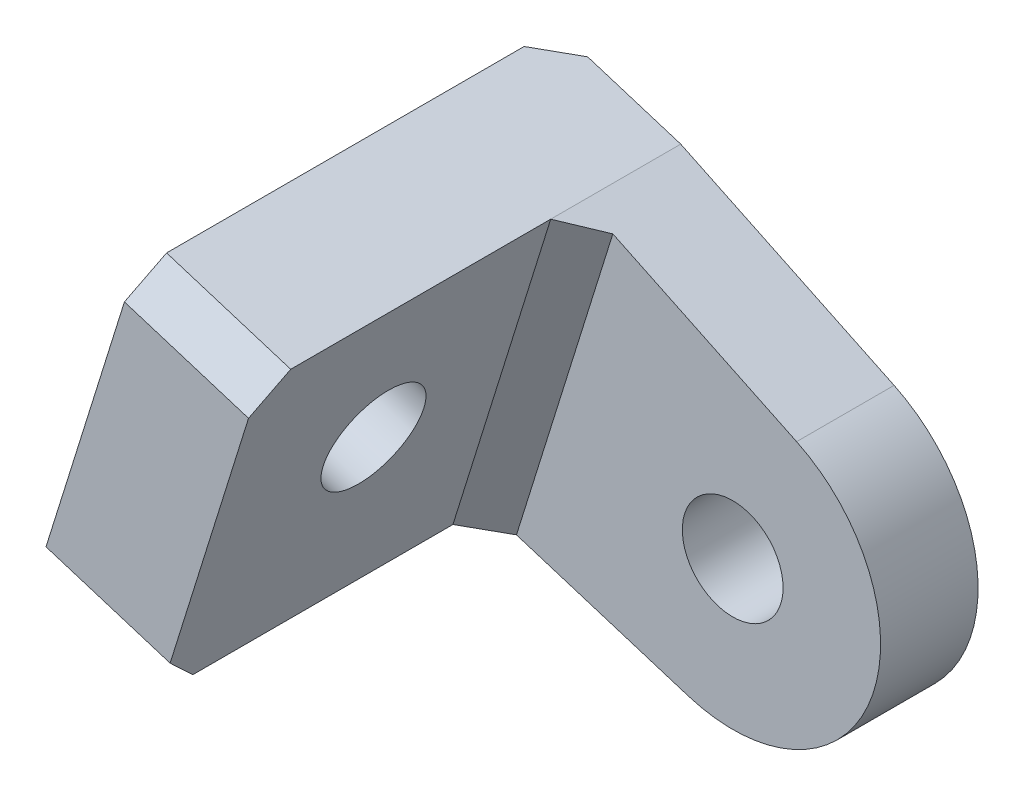
from build123d import *

# Parameters (mm, degrees)
SKETCH1_R           = 1.55
BOSS_EXTRUDE1_DEPTH = 3
BOSS_EXTRUDE2_DEPTH = 10
CUT_EXTRUDE1_REACH  = 40.814
SKETCH3_RX          = 1.55
SKETCH3_RY          = 1.549991194
CHAMFER1_SIZE       = 1
CHAMFER2_SIZE       = 1
CHAMFER3_SIZE       = 1


with BuildPart() as part:
    # Sketch1 → Boss-Extrude1 (new body)
    with BuildSketch(Plane.XY):
        with BuildLine():
            Line((9.241088209, 28.022032198), (2.675653796, 31.16807272))
            Line((2.675653796, 31.16807272), (-1.142729479, 32.359688918))
            Line((-1.142729479, 32.359688918), (-4.151560379, 22.718271148))
            Line((-4.151560379, 22.718271148), (5.91942551, 19.575383426))
            ThreePointArc((5.91942551, 19.575383426), (11.509238759, 22.253627274), (9.241088209, 28.022032198))
        make_face()
        with Locations((7.274888935, 23.918794401)):
            Circle(SKETCH1_R, mode=Mode.SUBTRACT)
    extrude(amount=BOSS_EXTRUDE1_DEPTH)

    # Sketch2 → Boss-Extrude2 (add)
    with BuildSketch(Plane.XY.offset(3)):
        Polygon((-1.142729479, 32.359688918), (-4.151560379, 22.718271148), (-0.333177104, 21.52665495), (2.675653796, 31.16807272), align=None)
    extrude(amount=BOSS_EXTRUDE2_DEPTH)

    # Sketch3 → Cut-Extrude1 (cut, up to next)
    with BuildSketch(Plane(origin=(-10.243698191, 3.196786653, 0), x_dir=(0, 0, 1), z_dir=(-0.9545958188131253, 0.297904049493287, 0)), mode=Mode.PRIVATE) as cut_extrude1_sk1:
        with Locations(Location((8.05588909, 25.857711156), (0, 0, -179.999999999))):
            Ellipse(SKETCH3_RX, SKETCH3_RY)
    cut_extrude1_tool1 = extrude(cut_extrude1_sk1.sketch, amount=-CUT_EXTRUDE1_REACH, mode=Mode.PRIVATE) & part.part
    add(cut_extrude1_tool1.solids().sort_by_distance((-2.540581, 27.88045, 8.055889))[0], mode=Mode.SUBTRACT)

    # Chamfer1
    chamfer1_edges = [part.edges().sort_by_distance(p)[0] for p in [
        (-2.242368741, 22.122463049, 13),
        (0.766462159, 31.763880819, 13),
    ]]
    chamfer(chamfer1_edges, length=CHAMFER1_SIZE)

    # Chamfer2
    chamfer2_edges = [part.edges().sort_by_distance(p)[0] for p in [
        (1.171238346, 26.347363835, 3),
    ]]
    chamfer(chamfer2_edges, length=CHAMFER2_SIZE)

    # Chamfer3
    chamfer3_edges = [part.edges().sort_by_distance(p)[0] for p in [
        (-2.647144929, 27.538980033, 0),
    ]]
    chamfer(chamfer3_edges, length=CHAMFER3_SIZE)


solid = part.part
